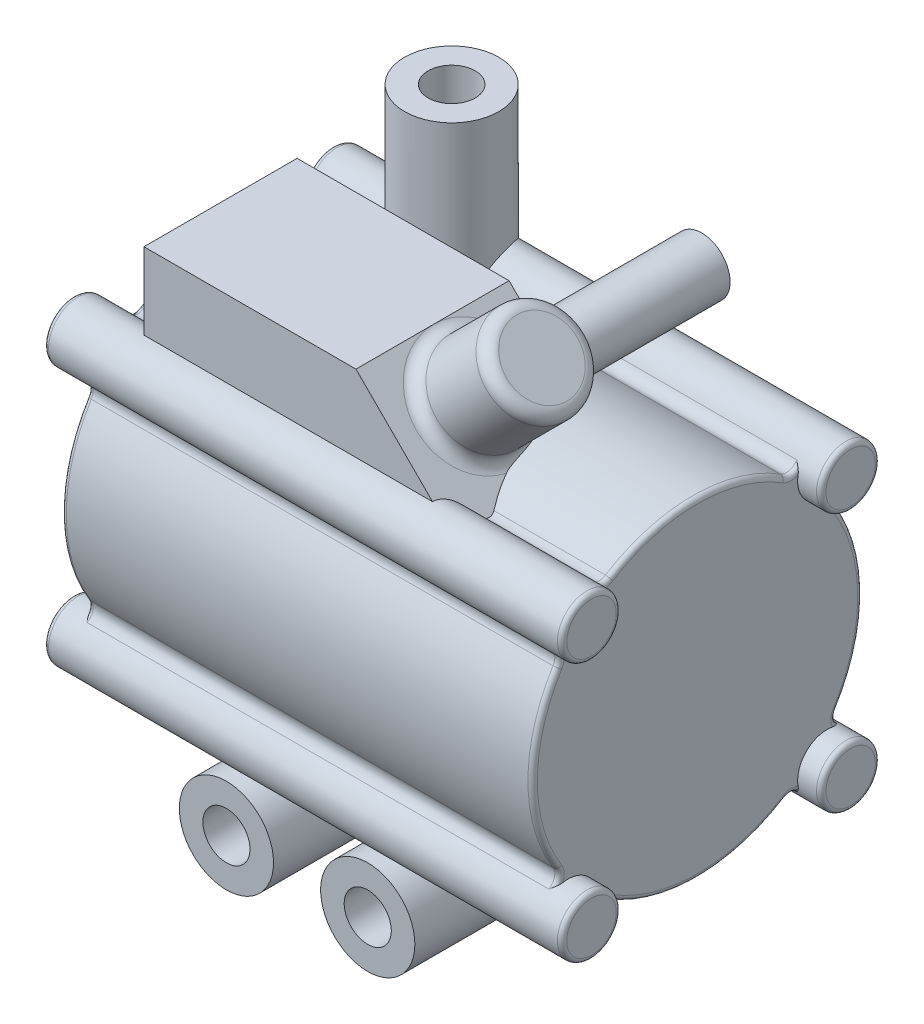
from build123d import *
from build123d.topology import SkipClean

# Parameters (mm, degrees)
BOSS_EXTRUDE1_DEPTH      = 50
BOSS_EXTRUDE1_DEPTH_BACK = 50
BOSS_EXTRUDE2_DEPTH      = 55
BOSS_EXTRUDE2_DEPTH_BACK = 55
SKETCH2_R                = 6.25
FILLET1_R                = 1
FILLET2_R                = 1
BOSS_EXTRUDE3_DEPTH      = 35
BOSS_EXTRUDE3_DEPTH_BACK = 35
SKETCH3_R                = 10
SKETCH3_R_2              = 5
SKETCH4_R                = 10
SKETCH4_R_2              = 5
BOSS_EXTRUDE5_DEPTH      = 60
BOSS_EXTRUDE6_DEPTH      = 27.5
BOSS_EXTRUDE6_DEPTH_BACK = 5
SKETCH8_R                = 10
BOSS_EXTRUDE7_DEPTH      = 20
BOSS_EXTRUDE8_DEPTH      = 10
BOSS_EXTRUDE8_DEPTH_BACK = 30
SKETCH9_R                = 6
SKETCH9_R_2              = 4
FILLET3_R                = 2.5
SKETCH10_R               = 7.5
CUT_EXTRUDE1_DEPTH       = 20


with BuildPart() as part:
    # Sketch1 → Boss-Extrude1 (new, two sides: drawn at the far end of the back side and taken through both)
    with BuildSketch(Plane(origin=(0, 0, 0), x_dir=(0, 0, -1), z_dir=(1, 0, 0)).offset(-BOSS_EXTRUDE1_DEPTH_BACK)):
        with BuildLine():
            ThreePointArc((18.553049004, 29.678011602), (0, 35), (-18.553049004, 29.678011602))
            ThreePointArc((-18.553049004, 29.678011602), (-20.495133355, 29.375169501), (-22.05590485, 30.569906838))
            ThreePointArc((-22.05590485, 30.569906838), (-31.919417382, 31.919417382), (-30.569906838, 22.05590485))
            ThreePointArc((-30.569906838, 22.05590485), (-29.375169501, 20.495133355), (-29.678011602, 18.553049004))
            ThreePointArc((-29.678011602, 18.553049004), (-35, 0), (-29.678011602, -18.553049004))
            ThreePointArc((-29.678011602, -18.553049004), (-29.375169501, -20.495133355), (-30.569906838, -22.05590485))
            ThreePointArc((-30.569906838, -22.05590485), (-31.919417382, -31.919417382), (-22.05590485, -30.569906838))
            ThreePointArc((-22.05590485, -30.569906838), (-20.495133355, -29.375169501), (-18.553049004, -29.678011602))
            ThreePointArc((-18.553049004, -29.678011602), (0, -35), (18.553049004, -29.678011602))
            ThreePointArc((18.553049004, -29.678011602), (20.495133355, -29.375169501), (22.05590485, -30.569906838))
            ThreePointArc((22.05590485, -30.569906838), (31.919417382, -31.919417382), (30.569906838, -22.05590485))
            ThreePointArc((30.569906838, -22.05590485), (29.375169501, -20.495133355), (29.678011602, -18.553049004))
            ThreePointArc((29.678011602, -18.553049004), (35, 0), (29.678011602, 18.553049004))
            ThreePointArc((29.678011602, 18.553049004), (29.375169501, 20.495133355), (30.569906838, 22.05590485))
            ThreePointArc((30.569906838, 22.05590485), (31.919417382, 31.919417382), (22.05590485, 30.569906838))
            ThreePointArc((22.05590485, 30.569906838), (20.495133355, 29.375169501), (18.553049004, 29.678011602))
        make_face()
    extrude(amount=BOSS_EXTRUDE1_DEPTH + BOSS_EXTRUDE1_DEPTH_BACK)

    # Sketch2 → Boss-Extrude2 (add, two sides: drawn at the far end of the back side and taken through both)
    with SkipClean():  # the faces are left unmerged after this step: merging them gives an invalid solid
        with BuildSketch(Plane(origin=(0, 0, 0), x_dir=(0, 0, -1), z_dir=(1, 0, 0)).offset(-BOSS_EXTRUDE2_DEPTH_BACK)):
            with Locations((-27.5, 27.5)):
                Circle(SKETCH2_R)
            with Locations((27.5, 27.5)):
                Circle(SKETCH2_R)
            with Locations((27.5, -27.5)):
                Circle(SKETCH2_R)
            with Locations((-27.5, -27.5)):
                Circle(SKETCH2_R)
        extrude(amount=BOSS_EXTRUDE2_DEPTH + BOSS_EXTRUDE2_DEPTH_BACK)
    add(part.part.scale(1), mode=Mode.REPLACE)  # the faces are merged on a copy

    # Fillet1
    fillet1_edges = [part.edges().sort_by_distance(p)[0] for p in [
        (-55, -27.5, 33.75),
        (55, -27.5, 33.75),
        (-55, 27.5, 33.75),
        (55, 27.5, 33.75),
        (-55, 27.5, -21.25),
        (55, 27.5, -21.25),
        (-55, -27.5, -21.25),
        (55, -27.5, -21.25),
    ]]
    fillet(fillet1_edges, radius=FILLET1_R)

    # Fillet2
    # the kernel refuses this fillet: 1 mm, written as the material it takes off along each edge
    with BuildSketch(Plane(origin=(50, 31.797869574, -19.87826679), x_dir=(0, 0.46795506701056017, -0.8837522589838976), z_dir=(0, 0.8837522589838976, 0.46795506701056017))) as fillet2_piece_1_section:
        with BuildLine():
            CenterArc((2.5 + FILLET2_R, FILLET2_R), FILLET2_R, 180, 90)
            Line((2.5 + FILLET2_R, 0), (2.5, 0))
            Line((2.5, 0), (2.5, FILLET2_R))
        make_face()
    fillet2_piece_1 = revolve(axis=Axis((50, 31.797869574, -19.87826679), (-1, 0, 0)), revolution_arc=149.912978169, mode=Mode.PRIVATE)
    fillet2_piece_1 = fillet2_piece_1 - Plane(origin=(49.747342596, 27.5, -27.5), x_dir=(0, 0, -1), z_dir=(-1, 0, 0)) * Cylinder(6.25, 15, mode=Mode.PRIVATE)
    add(fillet2_piece_1, mode=Mode.SUBTRACT)
    with BuildSketch(Plane(origin=(50, 0, 0), x_dir=(0, 0.8479431886343233, -0.5300871143959797), z_dir=(0, -0.5300871143959797, -0.8479431886343233))) as fillet2_piece_2:
        with BuildLine():
            CenterArc((35 - FILLET2_R, -FILLET2_R), FILLET2_R, 0, 90)
            Line((35, -FILLET2_R), (35, 0))
            Line((35, 0), (35 - FILLET2_R, 0))
        make_face()
    revolve(axis=Axis((50, 0, 0), (1, 0, 0)), revolution_arc=64.02268197, mode=Mode.SUBTRACT)
    with BuildSketch(Plane(origin=(50, 31.797869574, 19.87826679), x_dir=(0, -0.8479431886343237, -0.5300871143959789), z_dir=(0, 0.5300871143959789, -0.8479431886343237))) as fillet2_piece_3_section:
        with BuildLine():
            CenterArc((2.5 + FILLET2_R, FILLET2_R), FILLET2_R, 180, 90)
            Line((2.5, FILLET2_R), (2.5, 0))
            Line((2.5, 0), (2.5 + FILLET2_R, 0))
        make_face()
    fillet2_piece_3 = revolve(axis=Axis((50, 31.797869574, 19.87826679), (-1, 0, 0)), revolution_arc=149.912978169, mode=Mode.PRIVATE)
    fillet2_piece_3 = fillet2_piece_3 - Plane(origin=(49.836395702, 27.5, 27.5), x_dir=(0, 0, -1), z_dir=(-1, 0, 0)) * Cylinder(6.25, 15, mode=Mode.PRIVATE)
    add(fillet2_piece_3, mode=Mode.SUBTRACT)
    with BuildSketch(Plane(origin=(50, 19.87826679, 31.797869574), x_dir=(0, 0.8837522589838976, 0.46795506701056017), z_dir=(0, -0.46795506701056017, 0.8837522589838976))) as fillet2_piece_4_section:
        with BuildLine():
            CenterArc((2.5 + FILLET2_R, FILLET2_R), FILLET2_R, 180, 90)
            Line((2.5, FILLET2_R), (2.5, 0))
            Line((2.5, 0), (2.5 + FILLET2_R, 0))
        make_face()
    fillet2_piece_4 = revolve(axis=Axis((50, 19.87826679, 31.797869574), (-1, 0, 0)), revolution_arc=149.912978169, mode=Mode.PRIVATE)
    fillet2_piece_4 = fillet2_piece_4 - Plane(origin=(49.747342634, 27.5, 27.5), x_dir=(0, 0, -1), z_dir=(-1, 0, 0)) * Cylinder(6.25, 15, mode=Mode.PRIVATE)
    add(fillet2_piece_4, mode=Mode.SUBTRACT)
    with BuildSketch(Plane(origin=(50, 0, 0), x_dir=(0, 0.5300871143959798, 0.8479431886343232), z_dir=(0, 0.8479431886343232, -0.5300871143959798))) as fillet2_piece_5:
        with BuildLine():
            CenterArc((35 - FILLET2_R, -FILLET2_R), FILLET2_R, 0, 90)
            Line((35, -FILLET2_R), (35, 0))
            Line((35, 0), (35 - FILLET2_R, 0))
        make_face()
    revolve(axis=Axis((50, 0, 0), (1, 0, 0)), revolution_arc=64.02268197, mode=Mode.SUBTRACT)
    with BuildSketch(Plane(origin=(50, -19.87826679, 31.797869574), x_dir=(0, 0.5300871143959799, -0.8479431886343232), z_dir=(0, 0.8479431886343232, 0.5300871143959799))) as fillet2_piece_6_section:
        with BuildLine():
            CenterArc((2.5 + FILLET2_R, FILLET2_R), FILLET2_R, 180, 90)
            Line((2.5, FILLET2_R), (2.5, 0))
            Line((2.5, 0), (2.5 + FILLET2_R, 0))
        make_face()
    fillet2_piece_6 = revolve(axis=Axis((50, -19.87826679, 31.797869574), (-1, 0, 0)), revolution_arc=149.912978169, mode=Mode.PRIVATE)
    fillet2_piece_6 = fillet2_piece_6 - Plane(origin=(49.836395702, -27.5, 27.5), x_dir=(0, 0, -1), z_dir=(-1, 0, 0)) * Cylinder(6.25, 15, mode=Mode.PRIVATE)
    add(fillet2_piece_6, mode=Mode.SUBTRACT)
    with BuildSketch(Plane(origin=(-50, 19.87826679, -31.797869574), x_dir=(0, -0.5300871143959834, 0.8479431886343209), z_dir=(0, -0.8479431886343209, -0.5300871143959834))) as fillet2_piece_7_section:
        with BuildLine():
            CenterArc((2.5 + FILLET2_R, -FILLET2_R), FILLET2_R, 90, 90)
            Line((2.5, -FILLET2_R), (2.5, 0))
            Line((2.5, 0), (2.5 + FILLET2_R, 0))
        make_face()
    fillet2_piece_7 = revolve(axis=Axis((-50, 19.87826679, -31.797869574), (-1, 0, 0)), revolution_arc=149.912978169, mode=Mode.PRIVATE)
    fillet2_piece_7 = fillet2_piece_7 - Plane(origin=(-49.836395702, 27.5, -27.5), x_dir=(0, 0, -1), z_dir=(-1, 0, 0)) * Cylinder(6.25, 14, mode=Mode.PRIVATE)
    add(fillet2_piece_7, mode=Mode.SUBTRACT)
    with BuildSketch(Plane(origin=(-50, 0, 0), x_dir=(0, -0.5300871143959799, -0.8479431886343232), z_dir=(0, -0.8479431886343232, 0.5300871143959799))) as fillet2_piece_8:
        with BuildLine():
            CenterArc((35 - FILLET2_R, FILLET2_R), FILLET2_R, 270, 90)
            Line((35, FILLET2_R), (35, 0))
            Line((35, 0), (35 - FILLET2_R, 0))
        make_face()
    revolve(axis=Axis((-50, 0, 0), (1, 0, 0)), revolution_arc=64.02268197, mode=Mode.SUBTRACT)
    with BuildSketch(Plane(origin=(-50, -19.87826679, -31.797869574), x_dir=(0, -0.8837522589838976, -0.46795506701056017), z_dir=(0, 0.46795506701056017, -0.8837522589838976))) as fillet2_piece_9_section:
        with BuildLine():
            CenterArc((2.5 + FILLET2_R, -FILLET2_R), FILLET2_R, 90, 90)
            Line((2.5, -FILLET2_R), (2.5, 0))
            Line((2.5, 0), (2.5 + FILLET2_R, 0))
        make_face()
    fillet2_piece_9 = revolve(axis=Axis((-50, -19.87826679, -31.797869574), (-1, 0, 0)), revolution_arc=149.912978169, mode=Mode.PRIVATE)
    fillet2_piece_9 = fillet2_piece_9 - Plane(origin=(-49.747342593, -27.5, -27.5), x_dir=(0, -0.49118509414709893, 0.8710552240172293), z_dir=(-1, 0, 0)) * Cylinder(6.25, 15, mode=Mode.PRIVATE)
    add(fillet2_piece_9, mode=Mode.SUBTRACT)
    with BuildSketch(Plane(origin=(-50, -31.797869574, -19.87826679), x_dir=(0, 0.8479431886343237, 0.5300871143959789), z_dir=(0, -0.5300871143959789, 0.8479431886343237))) as fillet2_piece_10_section:
        with BuildLine():
            CenterArc((2.5 + FILLET2_R, -FILLET2_R), FILLET2_R, 90, 90)
            Line((2.5, -FILLET2_R), (2.5, 0))
            Line((2.5, 0), (2.5 + FILLET2_R, 0))
        make_face()
    fillet2_piece_10 = revolve(axis=Axis((-50, -31.797869574, -19.87826679), (-1, 0, 0)), revolution_arc=149.912978169, mode=Mode.PRIVATE)
    fillet2_piece_10 = fillet2_piece_10 - Plane(origin=(-49.836395702, -27.5, -27.5), x_dir=(0, -0.49118509414709893, 0.8710552240172293), z_dir=(-1, 0, 0)) * Cylinder(6.25, 15, mode=Mode.PRIVATE)
    add(fillet2_piece_10, mode=Mode.SUBTRACT)
    with BuildSketch(Plane(origin=(-50, 0, 0), x_dir=(0, -0.8479431886343233, 0.5300871143959798), z_dir=(0, 0.5300871143959798, 0.8479431886343233))) as fillet2_piece_11:
        with BuildLine():
            CenterArc((35 - FILLET2_R, FILLET2_R), FILLET2_R, 270, 90)
            Line((35, FILLET2_R), (35, 0))
            Line((35, 0), (35 - FILLET2_R, 0))
        make_face()
    revolve(axis=Axis((-50, 0, 0), (1, 0, 0)), revolution_arc=64.02268197, mode=Mode.SUBTRACT)
    with BuildSketch(Plane(origin=(-50, -31.797869574, 19.87826679), x_dir=(0, -0.46795506701056017, 0.8837522589838976), z_dir=(0, -0.8837522589838976, -0.46795506701056017))) as fillet2_piece_12_section:
        with BuildLine():
            CenterArc((2.5 + FILLET2_R, -FILLET2_R), FILLET2_R, 90, 90)
            Line((2.5, -FILLET2_R), (2.5, 0))
            Line((2.5, 0), (2.5 + FILLET2_R, 0))
        make_face()
    fillet2_piece_12 = revolve(axis=Axis((-50, -31.797869574, 19.87826679), (-1, 0, 0)), revolution_arc=149.912978169, mode=Mode.PRIVATE)
    fillet2_piece_12 = fillet2_piece_12 - Plane(origin=(-49.747302505, -27.5, 27.5), x_dir=(0, 0, -1), z_dir=(-1, 0, 0)) * Cylinder(6.25, 15, mode=Mode.PRIVATE)
    add(fillet2_piece_12, mode=Mode.SUBTRACT)
    with BuildSketch(Plane(origin=(-50, -19.87826679, 31.797869574), x_dir=(0, 0.5300871143959799, -0.8479431886343232), z_dir=(0, 0.8479431886343232, 0.5300871143959799))) as fillet2_piece_13_section:
        with BuildLine():
            CenterArc((2.5 + FILLET2_R, -FILLET2_R), FILLET2_R, 90, 90)
            Line((2.5, -FILLET2_R), (2.5, 0))
            Line((2.5, 0), (2.5 + FILLET2_R, 0))
        make_face()
    fillet2_piece_13 = revolve(axis=Axis((-50, -19.87826679, 31.797869574), (-1, 0, 0)), revolution_arc=149.912978169, mode=Mode.PRIVATE)
    fillet2_piece_13 = fillet2_piece_13 - Plane(origin=(-49.836395702, -27.5, 27.5), x_dir=(0, 0, -1), z_dir=(-1, 0, 0)) * Cylinder(6.25, 15, mode=Mode.PRIVATE)
    add(fillet2_piece_13, mode=Mode.SUBTRACT)
    with BuildSketch(Plane(origin=(-50, 0, 0), x_dir=(0, 0.5300871143959798, 0.8479431886343232), z_dir=(0, 0.8479431886343232, -0.5300871143959798))) as fillet2_piece_14:
        with BuildLine():
            CenterArc((35 - FILLET2_R, FILLET2_R), FILLET2_R, 270, 90)
            Line((35, FILLET2_R), (35, 0))
            Line((35, 0), (35 - FILLET2_R, 0))
        make_face()
    revolve(axis=Axis((-50, 0, 0), (1, 0, 0)), revolution_arc=64.02268197, mode=Mode.SUBTRACT)
    with BuildSketch(Plane(origin=(-50, 19.87826679, 31.797869574), x_dir=(0, 0.8837522589838976, 0.46795506701056017), z_dir=(0, -0.46795506701056017, 0.8837522589838976))) as fillet2_piece_15_section:
        with BuildLine():
            CenterArc((2.5 + FILLET2_R, -FILLET2_R), FILLET2_R, 90, 90)
            Line((2.5, -FILLET2_R), (2.5, 0))
            Line((2.5, 0), (2.5 + FILLET2_R, 0))
        make_face()
    fillet2_piece_15 = revolve(axis=Axis((-50, 19.87826679, 31.797869574), (-1, 0, 0)), revolution_arc=149.912978169, mode=Mode.PRIVATE)
    fillet2_piece_15 = fillet2_piece_15 - Plane(origin=(-49.747342634, 27.5, 27.5), x_dir=(0, 0, -1), z_dir=(-1, 0, 0)) * Cylinder(6.25, 15, mode=Mode.PRIVATE)
    add(fillet2_piece_15, mode=Mode.SUBTRACT)
    with BuildSketch(Plane(origin=(-50, 31.797869574, 19.87826679), x_dir=(0, -0.8479431886343237, -0.5300871143959789), z_dir=(0, 0.5300871143959789, -0.8479431886343237))) as fillet2_piece_16_section:
        with BuildLine():
            CenterArc((2.5 + FILLET2_R, -FILLET2_R), FILLET2_R, 90, 90)
            Line((2.5, -FILLET2_R), (2.5, 0))
            Line((2.5, 0), (2.5 + FILLET2_R, 0))
        make_face()
    fillet2_piece_16 = revolve(axis=Axis((-50, 31.797869574, 19.87826679), (-1, 0, 0)), revolution_arc=149.912978169, mode=Mode.PRIVATE)
    fillet2_piece_16 = fillet2_piece_16 - Plane(origin=(-49.836395702, 27.5, 27.5), x_dir=(0, 0, -1), z_dir=(-1, 0, 0)) * Cylinder(6.25, 15, mode=Mode.PRIVATE)
    add(fillet2_piece_16, mode=Mode.SUBTRACT)
    with BuildSketch(Plane(origin=(-50, 0, 0), x_dir=(0, 0.8479431886343233, -0.5300871143959797), z_dir=(0, -0.5300871143959797, -0.8479431886343233))) as fillet2_piece_17:
        with BuildLine():
            CenterArc((35 - FILLET2_R, FILLET2_R), FILLET2_R, 270, 90)
            Line((35, FILLET2_R), (35, 0))
            Line((35, 0), (35 - FILLET2_R, 0))
        make_face()
    revolve(axis=Axis((-50, 0, 0), (1, 0, 0)), revolution_arc=64.02268197, mode=Mode.SUBTRACT)
    with BuildSketch(Plane(origin=(-50, 31.797869574, -19.87826679), x_dir=(0, 0.46795506701056017, -0.8837522589838976), z_dir=(0, 0.8837522589838976, 0.46795506701056017))) as fillet2_piece_18_section:
        with BuildLine():
            CenterArc((2.5 + FILLET2_R, -FILLET2_R), FILLET2_R, 90, 90)
            Line((2.5, -FILLET2_R), (2.5, 0))
            Line((2.5, 0), (2.5 + FILLET2_R, 0))
        make_face()
    fillet2_piece_18 = revolve(axis=Axis((-50, 31.797869574, -19.87826679), (-1, 0, 0)), revolution_arc=149.912978169, mode=Mode.PRIVATE)
    fillet2_piece_18 = fillet2_piece_18 - Plane(origin=(-49.747342593, 27.5, -27.5), x_dir=(0, 0, -1), z_dir=(-1, 0, 0)) * Cylinder(6.25, 15, mode=Mode.PRIVATE)
    add(fillet2_piece_18, mode=Mode.SUBTRACT)
    with BuildSketch(Plane(origin=(50, -31.797869574, 19.87826679), x_dir=(0, -0.46795506701056017, 0.8837522589838976), z_dir=(0, -0.8837522589838976, -0.46795506701056017))) as fillet2_piece_19_section:
        with BuildLine():
            CenterArc((2.5 + FILLET2_R, FILLET2_R), FILLET2_R, 180, 90)
            Line((2.5, FILLET2_R), (2.5, 0))
            Line((2.5, 0), (2.5 + FILLET2_R, 0))
        make_face()
    fillet2_piece_19 = revolve(axis=Axis((50, -31.797869574, 19.87826679), (-1, 0, 0)), revolution_arc=149.912978169, mode=Mode.PRIVATE)
    fillet2_piece_19 = fillet2_piece_19 - Plane(origin=(49.747302505, -27.5, 27.5), x_dir=(0, 0, -1), z_dir=(-1, 0, 0)) * Cylinder(6.25, 15, mode=Mode.PRIVATE)
    add(fillet2_piece_19, mode=Mode.SUBTRACT)
    with BuildSketch(Plane(origin=(50, 0, 0), x_dir=(0, -0.8479431886343233, 0.5300871143959798), z_dir=(0, 0.5300871143959798, 0.8479431886343233))) as fillet2_piece_20:
        with BuildLine():
            CenterArc((35 - FILLET2_R, -FILLET2_R), FILLET2_R, 0, 90)
            Line((35, -FILLET2_R), (35, 0))
            Line((35, 0), (35 - FILLET2_R, 0))
        make_face()
    revolve(axis=Axis((50, 0, 0), (1, 0, 0)), revolution_arc=64.02268197, mode=Mode.SUBTRACT)
    with BuildSketch(Plane(origin=(50, 19.87826679, -31.797869574), x_dir=(0, -0.5300871143959834, 0.8479431886343209), z_dir=(0, -0.8479431886343209, -0.5300871143959834))) as fillet2_piece_21_section:
        with BuildLine():
            CenterArc((2.5 + FILLET2_R, FILLET2_R), FILLET2_R, 180, 90)
            Line((2.5 + FILLET2_R, 0), (2.5, 0))
            Line((2.5, 0), (2.5, FILLET2_R))
        make_face()
    fillet2_piece_21 = revolve(axis=Axis((50, 19.87826679, -31.797869574), (-1, 0, 0)), revolution_arc=149.912978169, mode=Mode.PRIVATE)
    fillet2_piece_21 = fillet2_piece_21 - Plane(origin=(49.747342594, 27.5, -27.5), x_dir=(0, 0, -1), z_dir=(-1, 0, 0)) * Cylinder(6.25, 14, mode=Mode.PRIVATE)
    add(fillet2_piece_21, mode=Mode.SUBTRACT)
    with BuildSketch(Plane(origin=(50, -31.797869574, -19.87826679), x_dir=(0, 0.8479431886343237, 0.5300871143959789), z_dir=(0, -0.5300871143959789, 0.8479431886343237))) as fillet2_piece_22_section:
        with BuildLine():
            CenterArc((2.5 + FILLET2_R, FILLET2_R), FILLET2_R, 180, 90)
            Line((2.5, FILLET2_R), (2.5, 0))
            Line((2.5, 0), (2.5 + FILLET2_R, 0))
        make_face()
    fillet2_piece_22 = revolve(axis=Axis((50, -31.797869574, -19.87826679), (-1, 0, 0)), revolution_arc=149.912978169, mode=Mode.PRIVATE)
    fillet2_piece_22 = fillet2_piece_22 - Plane(origin=(49.836395702, -27.5, -27.5), x_dir=(0, -0.49118509414709893, 0.8710552240172293), z_dir=(-1, 0, 0)) * Cylinder(6.25, 15, mode=Mode.PRIVATE)
    add(fillet2_piece_22, mode=Mode.SUBTRACT)
    with BuildSketch(Plane(origin=(50, -19.87826679, -31.797869574), x_dir=(0, -0.8837522589838976, -0.46795506701056017), z_dir=(0, 0.46795506701056017, -0.8837522589838976))) as fillet2_piece_23_section:
        with BuildLine():
            CenterArc((2.5 + FILLET2_R, FILLET2_R), FILLET2_R, 180, 90)
            Line((2.5, FILLET2_R), (2.5, 0))
            Line((2.5, 0), (2.5 + FILLET2_R, 0))
        make_face()
    fillet2_piece_23 = revolve(axis=Axis((50, -19.87826679, -31.797869574), (-1, 0, 0)), revolution_arc=149.912978169, mode=Mode.PRIVATE)
    fillet2_piece_23 = fillet2_piece_23 - Plane(origin=(49.747342593, -27.5, -27.5), x_dir=(0, -0.49118509414709893, 0.8710552240172293), z_dir=(-1, 0, 0)) * Cylinder(6.25, 15, mode=Mode.PRIVATE)
    add(fillet2_piece_23, mode=Mode.SUBTRACT)
    with BuildSketch(Plane(origin=(50, 0, 0), x_dir=(0, -0.5300871143959799, -0.8479431886343232), z_dir=(0, -0.8479431886343232, 0.5300871143959799))) as fillet2_piece_24:
        with BuildLine():
            CenterArc((35 - FILLET2_R, -FILLET2_R), FILLET2_R, 0, 90)
            Line((35, -FILLET2_R), (35, 0))
            Line((35, 0), (35 - FILLET2_R, 0))
        make_face()
    revolve(axis=Axis((50, 0, 0), (1, 0, 0)), revolution_arc=64.02268197, mode=Mode.SUBTRACT)

    # Sketch3 → Boss-Extrude3 (add, two sides: drawn at the far end of the back side and taken through both)
    # profile 1 of 2: a face of its own
    with SkipClean():  # the faces are left unmerged after this step: merging them gives an invalid solid
        with BuildSketch(Plane.XY.offset(-BOSS_EXTRUDE3_DEPTH_BACK)):
            with Locations((15, -42)):
                Circle(SKETCH3_R)
            with Locations((15, -42)):
                Circle(SKETCH3_R_2, mode=Mode.SUBTRACT)
        # profile 2 of 2: a face of its own
        with BuildSketch(Plane.XY.offset(-BOSS_EXTRUDE3_DEPTH_BACK)):
            with Locations((-15, -42)):
                Circle(SKETCH3_R)
            with Locations((-15, -42)):
                Circle(SKETCH3_R_2, mode=Mode.SUBTRACT)
        extrude(amount=BOSS_EXTRUDE3_DEPTH + BOSS_EXTRUDE3_DEPTH_BACK)

    # Sketch4 → Boss-Extrude5 (add)
    with SkipClean():  # the faces are left unmerged after this step: merging them gives an invalid solid
        with BuildSketch(Plane(origin=(0, 0, 0), x_dir=(1, 0, 0), z_dir=(0, 1, 0))):
            with Locations(Location((-27.182383011, 25, 0), (0, 0, 90))):
                Circle(SKETCH4_R)
            with Locations(Location((-27.182383011, 25, 0), (0, 0, 323.926752296))):
                Circle(SKETCH4_R_2, mode=Mode.SUBTRACT)
        extrude(amount=BOSS_EXTRUDE5_DEPTH)

    # Sketch7 → Boss-Extrude6 (add, two sides: drawn at the far end of the back side and taken through both)
    with SkipClean():  # the faces are left unmerged after this step: merging them gives an invalid solid
        with BuildSketch(Plane.XY.offset(-BOSS_EXTRUDE6_DEPTH_BACK)):
            Polygon((-40, 25), (-40, 50), (5, 50), (30, 25), align=None)
        extrude(amount=BOSS_EXTRUDE6_DEPTH + BOSS_EXTRUDE6_DEPTH_BACK)

    # Sketch8 → Boss-Extrude7 (add)
    with SkipClean():  # the faces are left unmerged after this step: merging them gives an invalid solid
        with BuildSketch(Plane(origin=(27.5, 27.5, 0), x_dir=(0, 0, -1), z_dir=(0.7071067811865435, 0.7071067811865517, 0))):
            with Locations(Location((-11, 19.319805153, 0), (0, 0, 90))):
                Circle(SKETCH8_R)
        extrude(amount=BOSS_EXTRUDE7_DEPTH)

    # Sketch9 → Boss-Extrude8 (add, two sides: drawn at the far end of the back side and taken through both)
    with SkipClean():  # the faces are left unmerged after this step: merging them gives an invalid solid
        with BuildSketch(Plane.XY.offset(-BOSS_EXTRUDE8_DEPTH_BACK)):
            with Locations((20.909902577, 48.232233047)):
                Circle(SKETCH9_R)
            with Locations((20.909902577, 48.232233047)):
                Circle(SKETCH9_R_2, mode=Mode.SUBTRACT)
        extrude(amount=BOSS_EXTRUDE8_DEPTH + BOSS_EXTRUDE8_DEPTH_BACK)

    # Fillet3
    # the kernel refuses this fillet: 2.5 mm, written as the material it adds along each edge
    with BuildSketch(Plane(origin=(13.838834765, 41.161165235, 11), x_dir=(-0.7071067811865515, 0.7071067811865435, 0), z_dir=(0, 0, -1))) as fillet3_piece_1:
        with BuildLine():
            CenterArc((10 + FILLET3_R, FILLET3_R), FILLET3_R, 180, 90)
            Line((10, FILLET3_R), (10, 0))
            Line((10, 0), (10 + FILLET3_R, 0))
        make_face()
    revolve(axis=Axis((13.838834765, 41.161165235, 11), (0.7071067811865435, 0.7071067811865517, 0)))
    # the kernel refuses this fillet: 2.5 mm, written as the material it takes off along each edge
    with BuildSketch(Plane(origin=(27.980970389, 55.303300859, 11), x_dir=(-0.7071067811865519, 0.707106781186543, 0), z_dir=(0, 0, -1))) as fillet3_2_piece_1:
        with BuildLine():
            CenterArc((10 - FILLET3_R, -FILLET3_R), FILLET3_R, 360, 90)
            Line((10 - FILLET3_R, 0), (10, 0))
            Line((10, 0), (10, -FILLET3_R))
        make_face()
    revolve(axis=Axis((27.980970389, 55.303300859, 11), (0.7071067811865435, 0.7071067811865517, 0)), mode=Mode.SUBTRACT)

    # Sketch10 → Cut-Extrude1 (cut)
    with BuildSketch(Plane.ZY.offset(50)):
        Circle(SKETCH10_R)
    extrude(amount=-CUT_EXTRUDE1_DEPTH, mode=Mode.SUBTRACT)


solid = part.part
